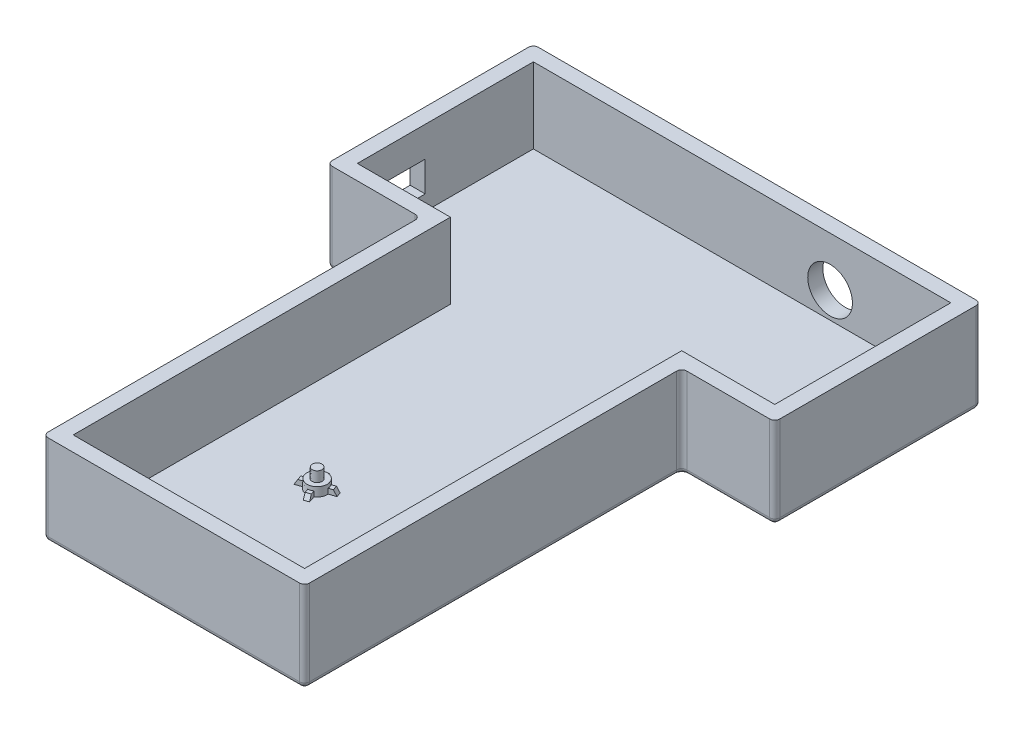
from build123d import *

# Parameters (mm, degrees)
BOSS_EXTRUDE1_DEPTH = 15
SHELL1_T            = 3
SKETCH2_W           = 10.2
SKETCH2_H           = 6
CUT_EXTRUDE1_DEPTH  = 4
SKETCH6_R           = 4.445
CUT_EXTRUDE2_DEPTH  = 4
FILLET1_R           = 1


with BuildPart() as part:
    # Sketch1 → Boss-Extrude1 (new body)
    with BuildSketch(Plane(origin=(0, 0, 0), x_dir=(1, 0, 0), z_dir=(0, 1, 0))):
        Polygon((64.5, 0), (18.5, 0), (18.5, 75), (0, 75), (0, 110), (83, 110), (83, 75), (64.5, 75), align=None)
    extrude(amount=BOSS_EXTRUDE1_DEPTH)

    # Shell1
    shell1_openings = [part.faces().sort_by_distance(p)[0] for p in [
        (41.5, 15, -62.641620771),
    ]]
    offset(amount=SHELL1_T, openings=shell1_openings, kind=Kind.INTERSECTION)

    # Sketch2 → Cut-Extrude1 (cut)
    with BuildSketch(Plane.ZY.offset(3)):
        with Locations((-83.4, 6)):
            Rectangle(SKETCH2_W, SKETCH2_H)
    extrude(amount=-CUT_EXTRUDE1_DEPTH, mode=Mode.SUBTRACT)

    # Mounting Boss1: read off the stored shape, not the designer's step
    # Mounting Boss1 outline → Mounting Boss1 (revolve)
    with BuildSketch(Plane(origin=(37, 0, -30), x_dir=(1, 0, 0), z_dir=(0, 0, 1))):
        Polygon((2, 1.746), (1, 1.746), (0.96508987, 3.746), (0, 3.746), (0, 0), (2.060971664, 0), align=None)
    revolve(axis=Axis((37, 0, -30), (0, 1, 0)))

    # Mounting Boss1 2: loft between two sections, ruled curve by curve
    mounting_boss1_2_from = [
        Edge.make_line((36.406329718, 0, -33.362149675), (36.84207555, 0, -32.05491218)),
        Edge.make_line((35.893392252, 0, -31.738684414), (35.45764642, 0, -33.045921909)),
        Edge.make_line((36.406329718, 0, -33.362149675), (35.45764642, 0, -33.045921909)),
        Edge.make_line((35.893392252, 0, -31.738684414), (36.84207555, 0, -32.05491218)),
    ]
    mounting_boss1_2_to = [
        Edge.make_line((36.572344576, 1, -32.808907341), (36.835525733, 1, -32.01936387)),
        Edge.make_line((35.919961092, 1, -31.714175657), (35.656779935, 1, -32.503719128)),
        Edge.make_line((36.572344576, 1, -32.808907341), (35.656779935, 1, -32.503719128)),
        Edge.make_line((35.919961092, 1, -31.714175657), (36.835525733, 1, -32.01936387)),
    ]
    mounting_boss1_2 = Solid(Shell([*[Face.make_surface_from_curves(mounting_boss1_2_from[k], mounting_boss1_2_to[k]) for k in range(4)], Face(Wire(mounting_boss1_2_from)), Face(Wire(mounting_boss1_2_to))]))
    add(mounting_boss1_2)

    # Mounting Boss1 3: loft between two sections, ruled curve by curve
    mounting_boss1_3_from = [
        Edge.make_line((38.106607748, 0, -28.261315586), (38.54235358, 0, -26.954078091)),
        Edge.make_line((37.593670282, 0, -26.637850325), (37.15792445, 0, -27.94508782)),
        Edge.make_line((37.593670282, 0, -26.637850325), (38.54235358, 0, -26.954078091)),
        Edge.make_line((37.15792445, 0, -27.94508782), (38.106607748, 0, -28.261315586)),
    ]
    mounting_boss1_3_to = [
        Edge.make_line((38.080038908, 1, -28.285824343), (38.343220065, 1, -27.496280872)),
        Edge.make_line((37.427655424, 1, -27.191092659), (37.164474267, 1, -27.98063613)),
        Edge.make_line((37.427655424, 1, -27.191092659), (38.343220065, 1, -27.496280872)),
        Edge.make_line((37.164474267, 1, -27.98063613), (38.080038908, 1, -28.285824343)),
    ]
    mounting_boss1_3 = Solid(Shell([*[Face.make_surface_from_curves(mounting_boss1_3_from[k], mounting_boss1_3_to[k]) for k in range(4)], Face(Wire(mounting_boss1_3_from)), Face(Wire(mounting_boss1_3_to))]))
    add(mounting_boss1_3)

    # Mounting Boss1 4: loft between two sections, ruled curve by curve
    mounting_boss1_4_from = [
        Edge.make_line((40.362149675, 0, -30.593670282), (39.05491218, 0, -30.15792445)),
        Edge.make_line((38.738684414, 0, -31.106607748), (40.045921909, 0, -31.54235358)),
        Edge.make_line((40.362149675, 0, -30.593670282), (40.045921909, 0, -31.54235358)),
        Edge.make_line((38.738684414, 0, -31.106607748), (39.05491218, 0, -30.15792445)),
    ]
    mounting_boss1_4_to = [
        Edge.make_line((39.808907341, 1, -30.427655424), (39.01936387, 1, -30.164474267)),
        Edge.make_line((38.714175657, 1, -31.080038908), (39.503719128, 1, -31.343220065)),
        Edge.make_line((39.808907341, 1, -30.427655424), (39.503719128, 1, -31.343220065)),
        Edge.make_line((38.714175657, 1, -31.080038908), (39.01936387, 1, -30.164474267)),
    ]
    mounting_boss1_4 = Solid(Shell([*[Face.make_surface_from_curves(mounting_boss1_4_from[k], mounting_boss1_4_to[k]) for k in range(4)], Face(Wire(mounting_boss1_4_from)), Face(Wire(mounting_boss1_4_to))]))
    add(mounting_boss1_4)

    # Mounting Boss1 5: loft between two sections, ruled curve by curve
    mounting_boss1_5_from = [
        Edge.make_line((35.261315586, 0, -28.893392252), (33.954078091, 0, -28.45764642)),
        Edge.make_line((33.637850325, 0, -29.406329718), (34.94508782, 0, -29.84207555)),
        Edge.make_line((33.637850325, 0, -29.406329718), (33.954078091, 0, -28.45764642)),
        Edge.make_line((34.94508782, 0, -29.84207555), (35.261315586, 0, -28.893392252)),
    ]
    mounting_boss1_5_to = [
        Edge.make_line((35.285824343, 1, -28.919961092), (34.496280872, 1, -28.656779935)),
        Edge.make_line((34.191092659, 1, -29.572344576), (34.98063613, 1, -29.835525733)),
        Edge.make_line((34.191092659, 1, -29.572344576), (34.496280872, 1, -28.656779935)),
        Edge.make_line((34.98063613, 1, -29.835525733), (35.285824343, 1, -28.919961092)),
    ]
    mounting_boss1_5 = Solid(Shell([*[Face.make_surface_from_curves(mounting_boss1_5_from[k], mounting_boss1_5_to[k]) for k in range(4)], Face(Wire(mounting_boss1_5_from)), Face(Wire(mounting_boss1_5_to))]))
    add(mounting_boss1_5)

    # Mounting Boss3: read off the stored shape, not the designer's step
    # Mounting Boss3 outline → Mounting Boss3 (revolve)
    with BuildSketch(Plane(origin=(77, 0, -82), x_dir=(1, 0, 0), z_dir=(0, 0, 1))):
        Polygon((2, 1.746), (1, 1.746), (0.895184441, 3.746), (0, 3.746), (0, 0), (2.060971664, 0), align=None)
    revolve(axis=Axis((77, 0, -82), (0, 1, 0)))

    # Mounting Boss3 2: loft between two sections, ruled curve by curve
    mounting_boss3_2_from = [
        Edge.make_line((76.406329718, 0, -85.362149675), (76.84207555, 0, -84.05491218)),
        Edge.make_line((75.893392252, 0, -83.738684414), (75.45764642, 0, -85.045921909)),
        Edge.make_line((76.406329718, 0, -85.362149675), (75.45764642, 0, -85.045921909)),
        Edge.make_line((75.893392252, 0, -83.738684414), (76.84207555, 0, -84.05491218)),
    ]
    mounting_boss3_2_to = [
        Edge.make_line((76.572344576, 1, -84.808907341), (76.835525733, 1, -84.01936387)),
        Edge.make_line((75.919961092, 1, -83.714175657), (75.656779935, 1, -84.503719128)),
        Edge.make_line((76.572344576, 1, -84.808907341), (75.656779935, 1, -84.503719128)),
        Edge.make_line((75.919961092, 1, -83.714175657), (76.835525733, 1, -84.01936387)),
    ]
    mounting_boss3_2 = Solid(Shell([*[Face.make_surface_from_curves(mounting_boss3_2_from[k], mounting_boss3_2_to[k]) for k in range(4)], Face(Wire(mounting_boss3_2_from)), Face(Wire(mounting_boss3_2_to))]))
    add(mounting_boss3_2)

    # Mounting Boss3 3: loft between two sections, ruled curve by curve
    mounting_boss3_3_from = [
        Edge.make_line((80.362149675, 0, -82.593670282), (79.05491218, 0, -82.15792445)),
        Edge.make_line((78.738684414, 0, -83.106607748), (80.045921909, 0, -83.54235358)),
        Edge.make_line((80.362149675, 0, -82.593670282), (80.045921909, 0, -83.54235358)),
        Edge.make_line((78.738684414, 0, -83.106607748), (79.05491218, 0, -82.15792445)),
    ]
    mounting_boss3_3_to = [
        Edge.make_line((79.808907341, 1, -82.427655424), (79.01936387, 1, -82.164474267)),
        Edge.make_line((78.714175657, 1, -83.080038908), (79.503719128, 1, -83.343220065)),
        Edge.make_line((79.808907341, 1, -82.427655424), (79.503719128, 1, -83.343220065)),
        Edge.make_line((78.714175657, 1, -83.080038908), (79.01936387, 1, -82.164474267)),
    ]
    mounting_boss3_3 = Solid(Shell([*[Face.make_surface_from_curves(mounting_boss3_3_from[k], mounting_boss3_3_to[k]) for k in range(4)], Face(Wire(mounting_boss3_3_from)), Face(Wire(mounting_boss3_3_to))]))
    add(mounting_boss3_3)

    # Mounting Boss3 4: loft between two sections, ruled curve by curve
    mounting_boss3_4_from = [
        Edge.make_line((78.106607748, 0, -80.261315586), (78.54235358, 0, -78.954078091)),
        Edge.make_line((77.593670282, 0, -78.637850325), (77.15792445, 0, -79.94508782)),
        Edge.make_line((77.593670282, 0, -78.637850325), (78.54235358, 0, -78.954078091)),
        Edge.make_line((77.15792445, 0, -79.94508782), (78.106607748, 0, -80.261315586)),
    ]
    mounting_boss3_4_to = [
        Edge.make_line((78.080038908, 1, -80.285824343), (78.343220065, 1, -79.496280872)),
        Edge.make_line((77.427655424, 1, -79.191092659), (77.164474267, 1, -79.98063613)),
        Edge.make_line((77.427655424, 1, -79.191092659), (78.343220065, 1, -79.496280872)),
        Edge.make_line((77.164474267, 1, -79.98063613), (78.080038908, 1, -80.285824343)),
    ]
    mounting_boss3_4 = Solid(Shell([*[Face.make_surface_from_curves(mounting_boss3_4_from[k], mounting_boss3_4_to[k]) for k in range(4)], Face(Wire(mounting_boss3_4_from)), Face(Wire(mounting_boss3_4_to))]))
    add(mounting_boss3_4)

    # Mounting Boss3 5: loft between two sections, ruled curve by curve
    mounting_boss3_5_from = [
        Edge.make_line((75.261315586, 0, -80.893392252), (73.954078091, 0, -80.45764642)),
        Edge.make_line((73.637850325, 0, -81.406329718), (74.94508782, 0, -81.84207555)),
        Edge.make_line((73.637850325, 0, -81.406329718), (73.954078091, 0, -80.45764642)),
        Edge.make_line((74.94508782, 0, -81.84207555), (75.261315586, 0, -80.893392252)),
    ]
    mounting_boss3_5_to = [
        Edge.make_line((75.285824343, 1, -80.919961092), (74.496280872, 1, -80.656779935)),
        Edge.make_line((74.191092659, 1, -81.572344576), (74.98063613, 1, -81.835525733)),
        Edge.make_line((74.191092659, 1, -81.572344576), (74.496280872, 1, -80.656779935)),
        Edge.make_line((74.98063613, 1, -81.835525733), (75.285824343, 1, -80.919961092)),
    ]
    mounting_boss3_5 = Solid(Shell([*[Face.make_surface_from_curves(mounting_boss3_5_from[k], mounting_boss3_5_to[k]) for k in range(4)], Face(Wire(mounting_boss3_5_from)), Face(Wire(mounting_boss3_5_to))]))
    add(mounting_boss3_5)

    # Sketch6 → Cut-Extrude2 (cut)
    with BuildSketch(Plane(origin=(0, 0, -113), x_dir=(-1, 0, 0), z_dir=(0, 0, -1))):
        with Locations((-59, 5.177822529)):
            Circle(SKETCH6_R)
    extrude(amount=-CUT_EXTRUDE2_DEPTH, mode=Mode.SUBTRACT)

    # Fillet1
    fillet1_edges = [part.edges().sort_by_distance(p)[0] for p in [
        (6.25, -3, -72),
        (-3, -3, -92.5),
        (41.5, -3, -113),
        (86, -3, -92.5),
        (76.75, -3, -72),
        (67.5, -3, -34.5),
        (41.5, -3, 3),
        (15.5, 6, 3),
        (15.5, 6, -72),
        (-3, 6, -72),
        (-3, 6, -113),
        (86, 6, -113),
        (86, 6, -72),
        (67.5, 6, -72),
        (67.5, 6, 3),
        (15.5, -3, -34.5),
    ]]
    fillet(fillet1_edges, radius=FILLET1_R)


solid = part.part
